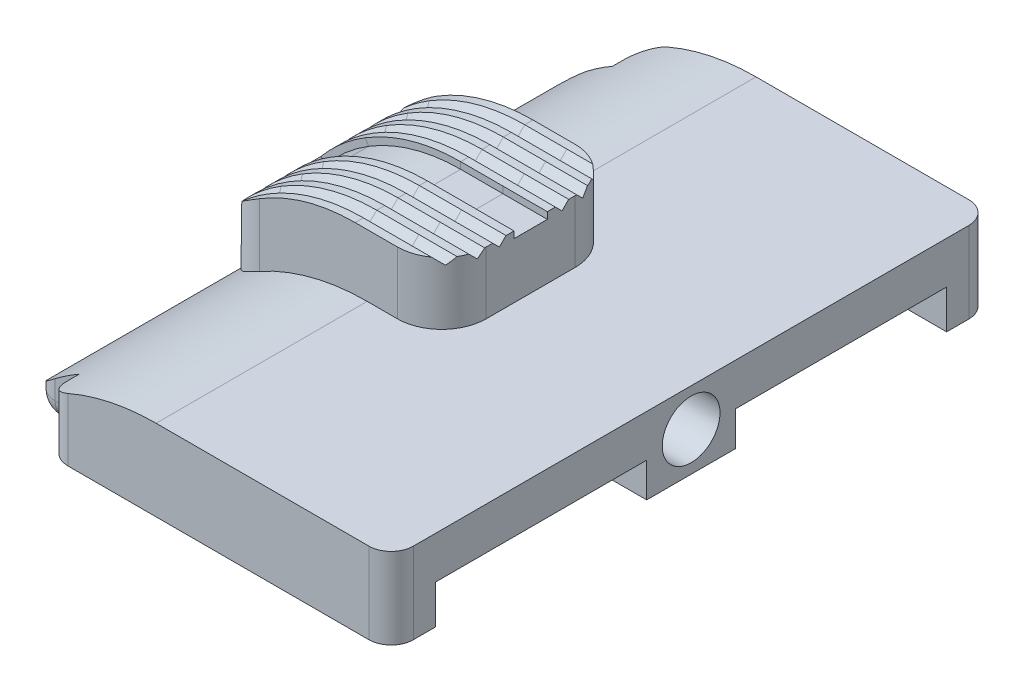
from build123d import *

# Parameters (mm, degrees)
BOSS_EXTRUDE1_DEPTH = 6
BOSS_EXTRUDE2_DEPTH = 2
FILLET1_R           = 1
BOSS_EXTRUDE3_DEPTH = 6.75
FILLET2_R           = 0.5
SKETCH6_R           = 0.65
CUT_EXTRUDE1_DEPTH  = 2.5
FILLET3_R           = 0.5
SKETCH8_W           = 3.5
SKETCH8_H           = 4.75
CUT_EXTRUDE2_DEPTH  = 1
SKETCH9_W           = 8.81
SKETCH9_H           = 0.125
CUT_EXTRUDE3_DEPTH  = 15.397730865
SKETCH10_W          = 3.5
SKETCH10_H          = 2
CUT_EXTRUDE4_DEPTH  = 0.1


with BuildPart() as part:
    # Sketch2 → Boss-Extrude1 (new, symmetric)
    with BuildSketch(Plane.XY):
        with BuildLine():
            Line((4.405, 0.975), (-0.883991622, 0.975))
            ThreePointArc((-0.883991622, 0.975), (-2.787934898, 0.598310502), (-4.405, -0.475))
            Line((-4.405, -0.475), (-4.405, -0.975))
            Line((-4.405, -0.975), (4.405, -0.975))
            Line((4.405, -0.975), (4.405, 0.975))
        make_face()
    extrude(amount=BOSS_EXTRUDE1_DEPTH, both=True)

    # Sketch3 → Boss-Extrude2 (add, symmetric)
    with BuildSketch(Plane.XY):
        with BuildLine():
            ThreePointArc((-1.155, 2.375), (-2.894244197, 1.987819633), (-4.305, 0.899404694))
            Line((-4.305, 0.899404694), (-4.305, -0.37853573))
            ThreePointArc((-4.305, -0.37853573), (-2.723513115, 0.624318302), (-0.883991622, 0.975))
            Line((-0.883991622, 0.975), (0.795, 0.975))
            Line((0.795, 0.975), (0.795, 2.375))
            Line((0.795, 2.375), (-1.155, 2.375))
        make_face()
    extrude(amount=BOSS_EXTRUDE2_DEPTH, both=True)

    # Fillet1
    fillet1_edges = [part.edges().sort_by_distance(p)[0] for p in [
        (0.795, 1.675, -2),
        (-4.305, 0.260434482, -2),
        (0.795, 1.675, 2),
        (-4.305, 0.260434482, 2),
    ]]
    fillet(fillet1_edges, radius=FILLET1_R)

    # Cut-Sweep1: sweep along a path in Sketch4
    with BuildLine(Plane.XY.offset(2)) as cut_sweep1_path:
        Line((0.795, 2.375), (-0.205, 2.375))
        Line((-0.205, 2.375), (-1.155, 2.375))
        ThreePointArc((-1.155, 2.375), (-2.27228554, 2.219828643), (-3.305, 1.766060011))
        ThreePointArc((-3.305, 1.766060011), (-3.840195125, 1.373342644), (-4.305, 0.899404694))
    # Sketch5 → Cut-Sweep1 (sweep, cut)
    with BuildSketch(Plane(origin=(0.795, 0, 0), x_dir=(0, 0, -1), z_dir=(1, 0, 0))):
        Polygon((-1.815, 2.375), (-1.665, 2.225), (-1.515, 2.375), (-1.335, 2.375), (-1.185, 2.225), (-1.035, 2.375), (-0.855, 2.375), (-0.705, 2.225), (-0.555, 2.375), (-0.375, 2.375), (-0.375, 2.225), (0.375, 2.225), (0.375, 2.375), (0.555, 2.375), (0.705, 2.225), (0.855, 2.375), (1.035, 2.375), (1.185, 2.225), (1.335, 2.375), (1.515, 2.375), (1.665, 2.225), (1.815, 2.375), (1.815, 2.475), (-1.815, 2.475), align=None)
    sweep(path=cut_sweep1_path.line, mode=Mode.SUBTRACT)

    # Sketch7 → Boss-Extrude3 (add, symmetric)
    with BuildSketch(Plane.XY):
        with BuildLine():
            Line((4.405, -0.975), (4.405, 0.975))
            Line((4.405, 0.975), (-0.883991622, 0.975))
            ThreePointArc((-0.883991622, 0.975), (-2.167505893, 0.807451874), (-3.365, 0.316036446))
            Line((-3.365, 0.316036446), (-3.365, -0.975))
            Line((-3.365, -0.975), (4.405, -0.975))
        make_face()
    extrude(amount=BOSS_EXTRUDE3_DEPTH, both=True)

    # Fillet2
    fillet2_edges = [part.edges().sort_by_distance(p)[0] for p in [
        (-4.405, -0.725, 6),
        (4.405, 0, -6.75),
        (-3.365, -0.329481777, -6.75),
        (4.405, 0, 6.75),
        (-3.365, -0.329481777, 6.75),
        (-4.405, -0.725, -6),
    ]]
    fillet(fillet2_edges, radius=FILLET2_R)

    # Sketch6 → Cut-Extrude1 (cut)
    with BuildSketch(Plane(origin=(4.405, 0, 0), x_dir=(0, 0, -1), z_dir=(1, 0, 0))):
        with Locations((0, 0.125)):
            Circle(SKETCH6_R)
    extrude(amount=-CUT_EXTRUDE1_DEPTH, mode=Mode.SUBTRACT)

    # Fillet3
    fillet3_edges = [part.edges().sort_by_distance(p)[0] for p in [
        (-3.635, -0.975, 6),
        (-4.258553391, -0.975, 5.853553391),
        (-3.635, -0.975, -6),
        (-4.258553391, -0.975, -5.853553391),
        (-4.405, -0.975, 0),
    ]]
    fillet(fillet3_edges, radius=FILLET3_R - 0.0001)  # a hair under: the kernel refuses the full size

    # Sketch8 → Cut-Extrude2 (cut)
    with BuildSketch(Plane.XZ.offset(0.975)):
        with Locations((2.655, -3.375)):
            Rectangle(SKETCH8_W, SKETCH8_H)
        with Locations((2.655, 3.375)):
            Rectangle(SKETCH8_W, SKETCH8_H)
    extrude(amount=-CUT_EXTRUDE2_DEPTH, mode=Mode.SUBTRACT)

    # Sketch9 → Cut-Extrude3 (cut, through all)
    with BuildSketch(Plane.XY.offset(6.75)):
        with Locations((0, -0.9125)):
            Rectangle(SKETCH9_W, SKETCH9_H)
    extrude(amount=-CUT_EXTRUDE3_DEPTH, mode=Mode.SUBTRACT)

    # Sketch10 → Cut-Extrude4 (cut)
    with BuildSketch(Plane.XZ.offset(0.85)):
        with Locations((2.655, 0)):
            Rectangle(SKETCH10_W, SKETCH10_H)
    extrude(amount=-CUT_EXTRUDE4_DEPTH, mode=Mode.SUBTRACT)


solid = part.part
